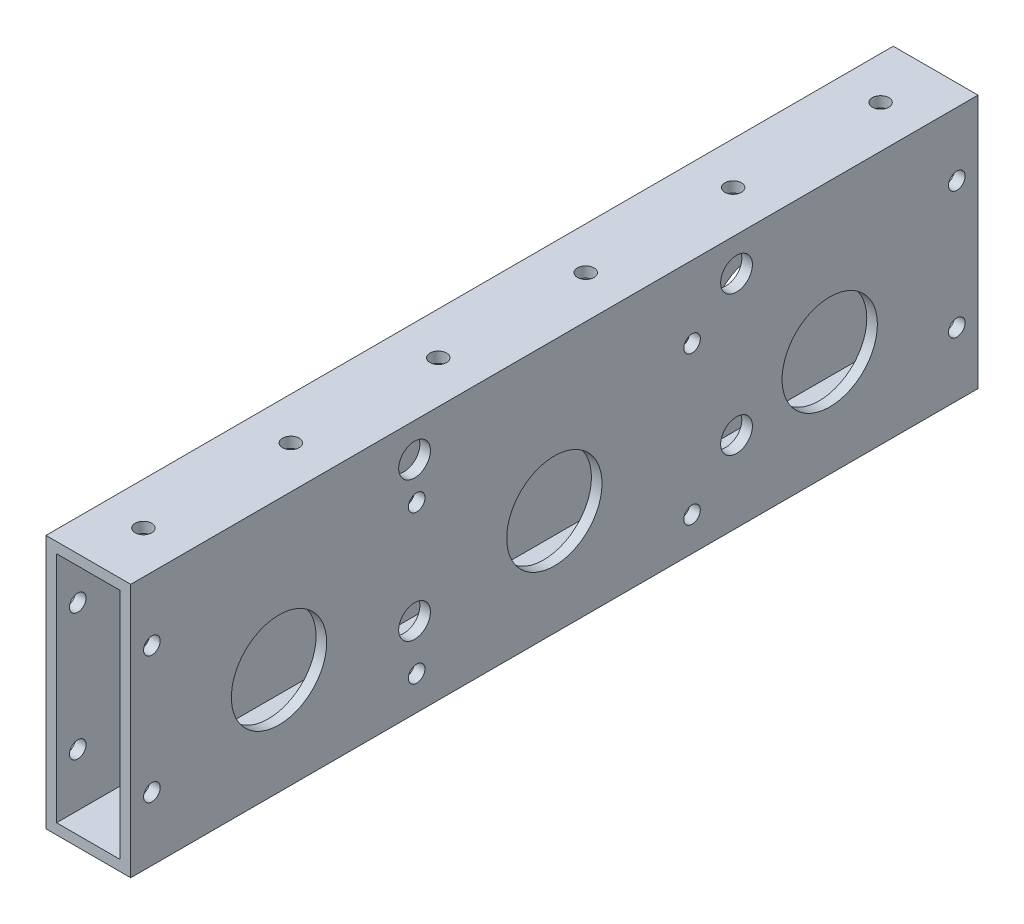
from build123d import *

# Parameters (mm, degrees)
SKETCH1_W                        = 254
SKETCH1_H                        = 76.2
BOSS_EXTRUDE1_DEPTH              = 25.4
SHELL1_T                         = -3.175
SKETCH2_R                        = 14.2875
CUT_EXTRUDE1_DEPTH               = 136.002851822
F_10_CLEARANCE_HOLE1_D           = 4.9784
F_10_CLEARANCE_HOLE2_D           = 4.9784
F_3_8_0_375_DIAMETER_HOLE1_D     = 9.525
F_3_8_0_375_DIAMETER_HOLE1_DEPTH = 12.7
F_3_8_0_375_DIAMETER_HOLE1_TIP   = 2.861598698
F_3_8_0_375_DIAMETER_HOLE2_D     = 9.525
F_3_8_0_375_DIAMETER_HOLE2_DEPTH = 12.7
F_3_8_0_375_DIAMETER_HOLE2_TIP   = 2.861598698
F_10_CLEARANCE_HOLE3_D           = 4.9784
F_10_CLEARANCE_HOLE3_DEPTH       = 12.7
F_10_CLEARANCE_HOLE3_TIP         = 1.495662253
F_10_CLEARANCE_HOLE4_D           = 4.9784
F_10_CLEARANCE_HOLE5_D           = 4.9784


with BuildPart() as part:
    # Sketch1 → Boss-Extrude1 (new body)
    with BuildSketch(Plane(origin=(0, 0, 0), x_dir=(0, 0, -1), z_dir=(1, 0, 0))):
        Rectangle(SKETCH1_W, SKETCH1_H)
    extrude(amount=BOSS_EXTRUDE1_DEPTH)

    # Shell1
    shell1_openings = [part.faces().sort_by_distance(p)[0] for p in [
        (12.7, 0, -127),
        (12.7, 0, 127),
    ]]
    offset(amount=SHELL1_T, openings=shell1_openings, kind=Kind.INTERSECTION)

    # Sketch2 → Cut-Extrude1 (cut, through all)
    with BuildSketch(Plane(origin=(25.4, 0, 0), x_dir=(0, 0, -1), z_dir=(1, 0, 0))):
        with Locations((0, -6.35)):
            Circle(SKETCH2_R)
        with Locations((-82.55, -6.35)):
            Circle(SKETCH2_R)
        with Locations((82.55, -6.35)):
            Circle(SKETCH2_R)
    extrude(amount=-CUT_EXTRUDE1_DEPTH, mode=Mode.SUBTRACT)

    # #10 Clearance Hole1 (through all)
    with Locations(Plane(origin=(25.4, 0, 0), x_dir=(0, 0, -1), z_dir=(1, 0, 0))):
        with Locations((-120.65, 19.05), (-120.65, -19.05)):
            f_10_clearance_hole1 = Hole(F_10_CLEARANCE_HOLE1_D / 2)

    # Mirror1: #10 Clearance Hole1 across plane
    add(f_10_clearance_hole1.mirror(Plane.XY), mode=Mode.SUBTRACT)

    # #10 Clearance Hole2 (through all)
    with Locations(Plane(origin=(25.4, 0, 0), x_dir=(0, 0, -1), z_dir=(1, 0, 0))):
        with Locations((-41.275, -27.94), (41.275, -27.94), (-41.275, 16.51), (41.275, 16.51)):
            Hole(F_10_CLEARANCE_HOLE2_D / 2)

    # 3/8 (0.375) Diameter Hole1
    with Locations(Plane.ZY):
        with Locations((-41.275, -27.94), (41.275, -27.94), (41.275, 16.51), (-41.275, 16.51)):
            Hole(F_3_8_0_375_DIAMETER_HOLE1_D / 2, depth=F_3_8_0_375_DIAMETER_HOLE1_DEPTH)
            with Locations((0, 0, -(F_3_8_0_375_DIAMETER_HOLE1_DEPTH + F_3_8_0_375_DIAMETER_HOLE1_TIP / 2))):  # 118° drill point
                Cone(0, F_3_8_0_375_DIAMETER_HOLE1_D / 2, F_3_8_0_375_DIAMETER_HOLE1_TIP, mode=Mode.SUBTRACT)

    # 3/8 (0.375) Diameter Hole2
    with Locations(Plane(origin=(25.4, 0, 0), x_dir=(0, 0, -1), z_dir=(1, 0, 0))):
        with Locations((-41.91, 27.94), (54.61, 27.94), (54.61, -13.97), (-41.91, -13.97)):
            Hole(F_3_8_0_375_DIAMETER_HOLE2_D / 2, depth=F_3_8_0_375_DIAMETER_HOLE2_DEPTH)
            with Locations((0, 0, -(F_3_8_0_375_DIAMETER_HOLE2_DEPTH + F_3_8_0_375_DIAMETER_HOLE2_TIP / 2))):  # 118° drill point
                Cone(0, F_3_8_0_375_DIAMETER_HOLE2_D / 2, F_3_8_0_375_DIAMETER_HOLE2_TIP, mode=Mode.SUBTRACT)

    # #10 Clearance Hole3
    with Locations(Plane.ZY):
        with Locations((41.91, 27.94), (-54.61, 27.94), (-54.61, -13.97), (41.91, -13.97)):
            Hole(F_10_CLEARANCE_HOLE3_D / 2, depth=F_10_CLEARANCE_HOLE3_DEPTH)
            with Locations((0, 0, -(F_10_CLEARANCE_HOLE3_DEPTH + F_10_CLEARANCE_HOLE3_TIP / 2))):  # 118° drill point
                Cone(0, F_10_CLEARANCE_HOLE3_D / 2, F_10_CLEARANCE_HOLE3_TIP, mode=Mode.SUBTRACT)

    # #10 Clearance Hole4 (through all)
    with Locations(Plane(origin=(0, -38.1, 0), x_dir=(-1, 0, 0), z_dir=(0, -1, 0))):
        with Locations((-12.7, -110.49), (-12.7, 110.49)):
            Hole(F_10_CLEARANCE_HOLE4_D / 2)

    # #10 Clearance Hole5 (through all)
    with Locations(Plane(origin=(0, 38.1, 0), x_dir=(1, 0, 0), z_dir=(0, 1, 0))):
        with Locations((12.7, 66.294), (12.7, 22.098)):
            f_10_clearance_hole5 = Hole(F_10_CLEARANCE_HOLE5_D / 2)

    # Mirror2: #10 Clearance Hole5 across plane
    add(f_10_clearance_hole5.mirror(Plane.XY), mode=Mode.SUBTRACT)


solid = part.part
